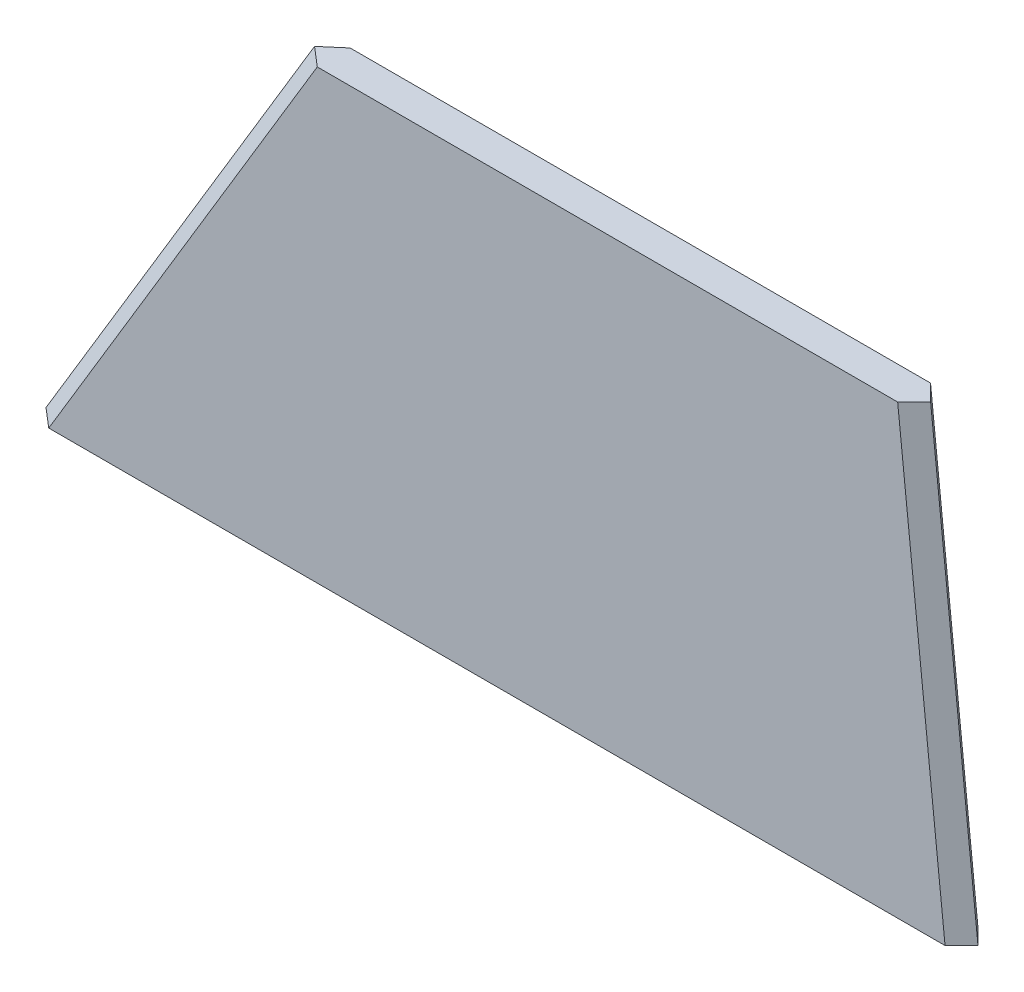
from build123d import *

# Parameters (mm, degrees)
BOSS_EXTRUDE1_DEPTH = 5.2832
CHAMFER3_SIZE       = 3.81


with BuildPart() as part:
    # Sketch2 → Boss-Extrude1 (new body)
    with BuildSketch(Plane.XY):
        Polygon((0, 0), (152.4, 0), (144.78, 71.882), (43.18, 71.882), align=None)
    extrude(amount=BOSS_EXTRUDE1_DEPTH)

    # Chamfer3
    # the kernel refuses this chamfer: 3.81 mm, written as the material it takes off along each edge
    with BuildSketch(Plane(origin=(153.432881845, -9.743518742, 5.2832), x_dir=(0.027342674184069608, 0.002898516697957921, -0.9996219169112969), z_dir=(-0.10541641348659767, 0.9944281672235671, 0))) as chamfer3_piece_1:
        Polygon((CHAMFER3_SIZE * 0.999621916911, CHAMFER3_SIZE * 0.0274958766106), (-CHAMFER3_SIZE * 0.0274958766106, CHAMFER3_SIZE * 0.999621916911), (0, 0), align=None)
    extrude(amount=91.880982955, mode=Mode.SUBTRACT)
    with BuildSketch(Plane(origin=(153.432881845, -9.743518742, 0), x_dir=(0.027342674184069608, 0.002898516697957921, 0.9996219169112969), z_dir=(-0.10541641348659767, 0.9944281672235671, 0))) as chamfer3_piece_2:
        Polygon((CHAMFER3_SIZE * 0.999621916911, -CHAMFER3_SIZE * 0.0274958766106), (-CHAMFER3_SIZE * 0.0274958766106, -CHAMFER3_SIZE * 0.999621916911), (0, 0), align=None)
    extrude(amount=91.880982955, mode=Mode.SUBTRACT)
    with BuildSketch(Plane(origin=(48.225451027, 80.281192003, 5.2832), x_dir=(-0.023570167662218693, 0.014158757959636668, -0.9996219169112966), z_dir=(-0.514941136817021, -0.8572255395248057, 0))) as chamfer3_piece_3:
        Polygon((CHAMFER3_SIZE * 0.999621916911, CHAMFER3_SIZE * 0.0274958766106), (-CHAMFER3_SIZE * 0.0274958766106, CHAMFER3_SIZE * 0.999621916911), (0, 0), align=None)
    extrude(amount=103.450468888, mode=Mode.SUBTRACT)
    with BuildSketch(Plane(origin=(48.225451027, 80.281192003, 0), x_dir=(-0.023570167662218693, 0.014158757959636668, 0.9996219169112966), z_dir=(-0.514941136817021, -0.8572255395248057, 0))) as chamfer3_piece_4:
        Polygon((CHAMFER3_SIZE * 0.999621916911, -CHAMFER3_SIZE * 0.0274958766106), (-CHAMFER3_SIZE * 0.0274958766106, -CHAMFER3_SIZE * 0.999621916911), (0, 0), align=None)
    extrude(amount=103.450468888, mode=Mode.SUBTRACT)


solid = part.part
